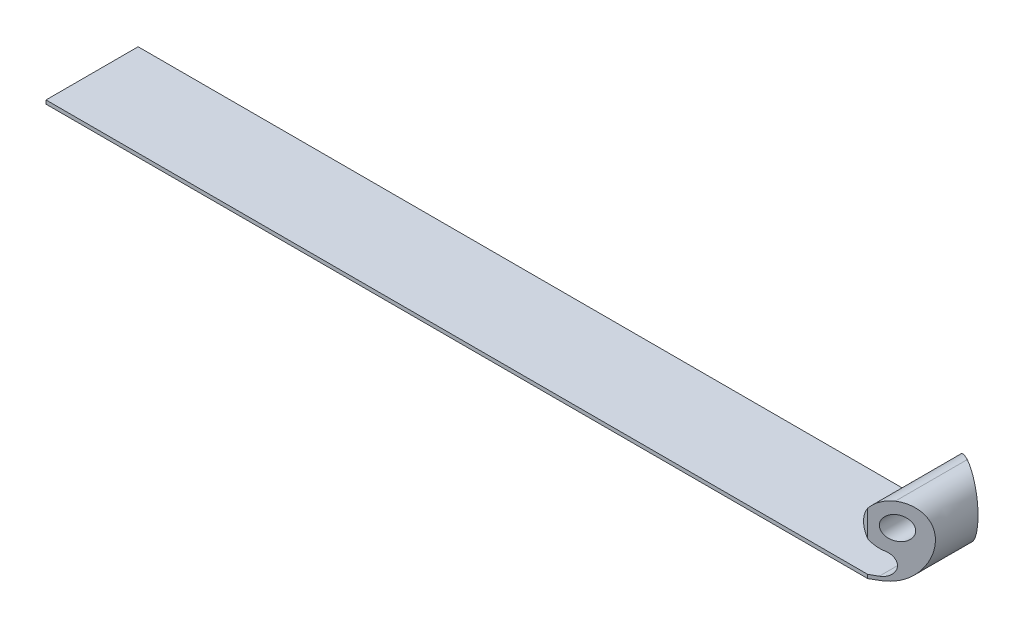
from build123d import *

# Parameters (mm, degrees)
SKETCH1_W               = 228.6
SKETCH1_H               = 25.4
BOSS_EXTRUDE1_DEPTH     = 1.016
BOSS_EXTRUDE2_START     = -25.4
BOSS_EXTRUDE2_OUTLINE_R = 3.175
BOSS_EXTRUDE2_DEPTH     = 25.4
CUT_EXTRUDE2_DEPTH      = 240.548137597


# Read off the part's stored shape, not the designer's step: Boss-Extrude2
with BuildPart() as part:
    # Sketch1 → Boss-Extrude1 (new body)
    with BuildSketch(Plane(origin=(0, 0, 0), x_dir=(1, 0, 0), z_dir=(0, 1, 0))):
        with Locations((114.3, 0)):
            Rectangle(SKETCH1_W, SKETCH1_H)
    extrude(amount=BOSS_EXTRUDE1_DEPTH)

    # Boss-Extrude2 outline → Boss-Extrude2 (add)
    with BuildSketch(Plane(origin=(0, 0, -12.7), x_dir=(-1, 0, 0), z_dir=(0, 0, -1)).offset(BOSS_EXTRUDE2_START)):
        with BuildLine():
            ThreePointArc((-229.658333333, 7.184418707), (-225.486151946, 14.050397837), (-231.381237899, 19.509035812))
            add(Edge.make_bspline(
                [(-231.381237899, 19.509035812), (-236.227087861, 19.810105296), (-241.340763982, 15.106028372), (-239.097965647, 8.031629833), (-236.573095563, 0), (-228.6, 0)],
                knots=[0, 0, 0, 0, 0, 0, 1, 1, 1, 1, 1, 1], degree=5))
            Line((-228.6, 0), (-228.6, 1.016))
            ThreePointArc((-228.6, 1.016), (-231.729275427, 3.654101218), (-229.658333333, 7.184418707))
        make_face()
        with Locations((-231.775, 13.171256121)):
            Circle(BOSS_EXTRUDE2_OUTLINE_R, mode=Mode.SUBTRACT)
    extrude(amount=BOSS_EXTRUDE2_DEPTH)

    # Sketch3 → Cut-Extrude2 (cut, through all)
    with BuildSketch(Plane.XZ):
        Polygon((226.576403153, 12.7), (238.413448409, 5.865878735), (238.413448409, 12.7), align=None)
        Polygon((226.576403153, -12.7), (238.413448409, -5.865878735), (238.413448409, -12.7), align=None)
    extrude(amount=-CUT_EXTRUDE2_DEPTH, mode=Mode.SUBTRACT)


solid = part.part
